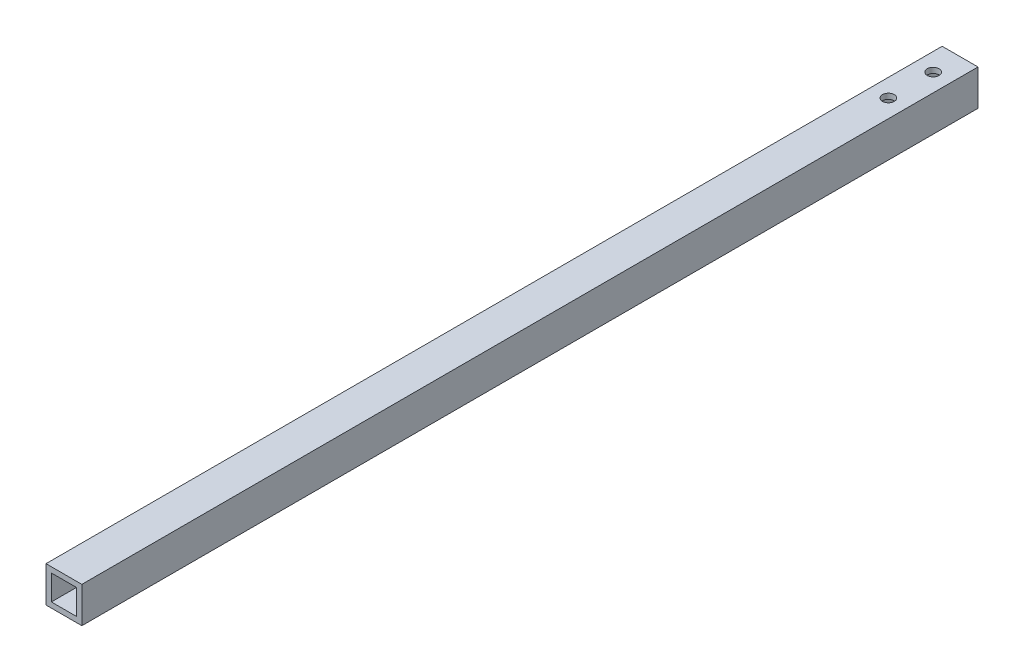
from build123d import *

# Parameters (mm, degrees)
SKETCH_1_W          = 10
SKETCH_1_H          = 10
SKETCH_1_W_2        = 7
SKETCH_1_H_2        = 7
EXTRUDE_1_DEPTH     = 250
SKETCH_2_R          = 1.65
CUT_EXTRUDE_1_DEPTH = 251.249875125


with BuildPart() as part:
    # 草图1 → 凸台-拉伸1 (new body)
    with BuildSketch(Plane.XY):
        Rectangle(SKETCH_1_W, SKETCH_1_H)
        Rectangle(SKETCH_1_W_2, SKETCH_1_H_2, mode=Mode.SUBTRACT)
    extrude(amount=EXTRUDE_1_DEPTH)

    # 草图2 → 切除-拉伸1 (cut, through all)
    with BuildSketch(Plane(origin=(0, 5, 0), x_dir=(1, 0, 0), z_dir=(0, 1, 0))):
        with Locations((0, -7.5)):
            Circle(SKETCH_2_R)
        with Locations((0, -20)):
            Circle(SKETCH_2_R)
    extrude(amount=-CUT_EXTRUDE_1_DEPTH, mode=Mode.SUBTRACT)


solid = part.part
